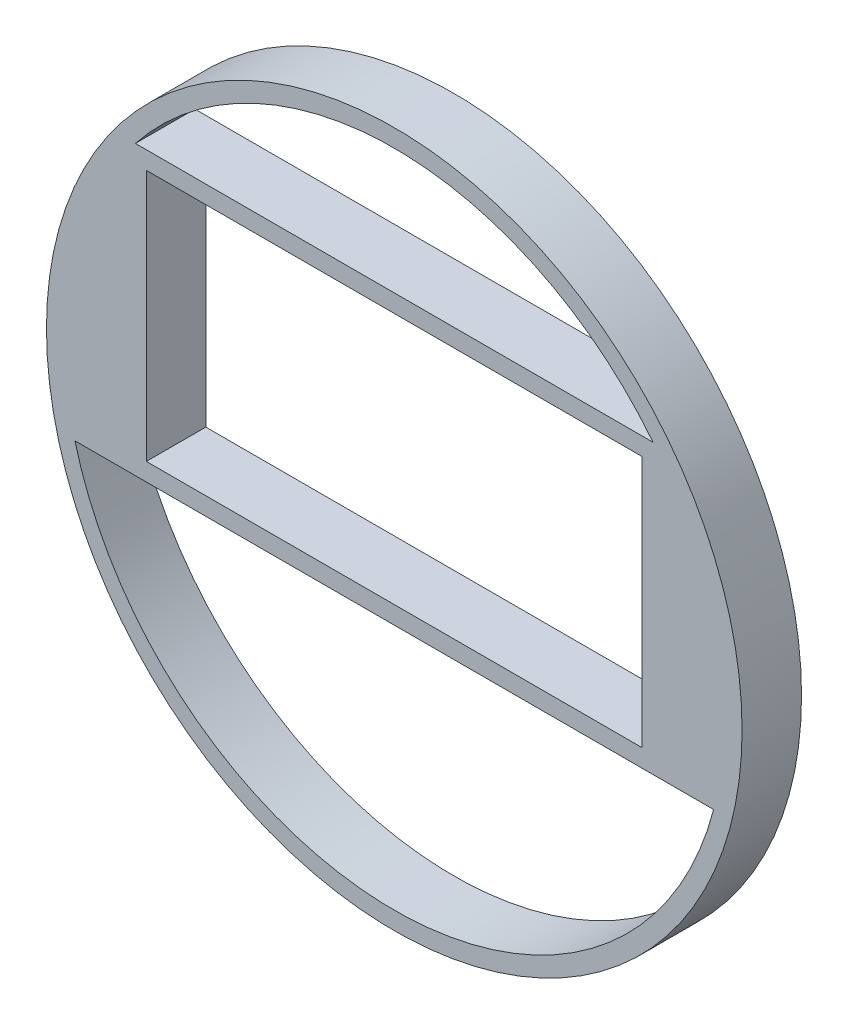
from build123d import *

# Parameters (mm, degrees)
SKIZZE1_R                       = 58.5
AUFSATZ_LINEAR_AUSTRAGEN1_DEPTH = 0.001
AUFSATZ_LINEAR_START            = 10
SKIZZE3_R                       = 58.5
AUFSATZ_LINEAR_AUSTRAGEN2_DEPTH = 10
SKIZZE10_W                      = 83.4
SKIZZE10_H                      = 42.4
SCHNITT_LINEAR_AUSTRAGEN4_DEPTH = 84.333786671


with BuildPart() as part:
    # Skizze1 → Aufsatz-Linear austragen1 (new body)
    with BuildSketch(Plane.XY):
        Circle(SKIZZE1_R)
    extrude(amount=AUFSATZ_LINEAR_AUSTRAGEN1_DEPTH)

    # Skizze3 → Aufsatz-Linear austragen2 (add)
    with BuildSketch(Plane(origin=(0, 0, 0), x_dir=(-1, 0, 0), z_dir=(0, 0, -1)).offset(AUFSATZ_LINEAR_START)):
        Circle(SKIZZE3_R)
    extrude(amount=-AUFSATZ_LINEAR_AUSTRAGEN2_DEPTH)

    # Skizze10 → Schnitt-Linear austragen4 (cut, through all)
    with BuildSketch(Plane(origin=(0, 0, -10), x_dir=(-1, 0, 0), z_dir=(0, 0, -1))):
        with Locations((0, 10.216670468)):
            Rectangle(SKIZZE10_W, SKIZZE10_H)
        with BuildLine():
            Line((-43.540128547, 34.416670468), (43.540128547, 34.416670468))
            ThreePointArc((43.540128547, 34.416670468), (0, 55.5), (-43.540128547, 34.416670468))
        make_face()
        with BuildLine():
            ThreePointArc((-53.709556833, -13.983329532), (0, -55.5), (53.709556833, -13.983329532))
            Line((53.709556833, -13.983329532), (-53.709556833, -13.983329532))
        make_face()
    extrude(amount=-SCHNITT_LINEAR_AUSTRAGEN4_DEPTH, mode=Mode.SUBTRACT)


solid = part.part
